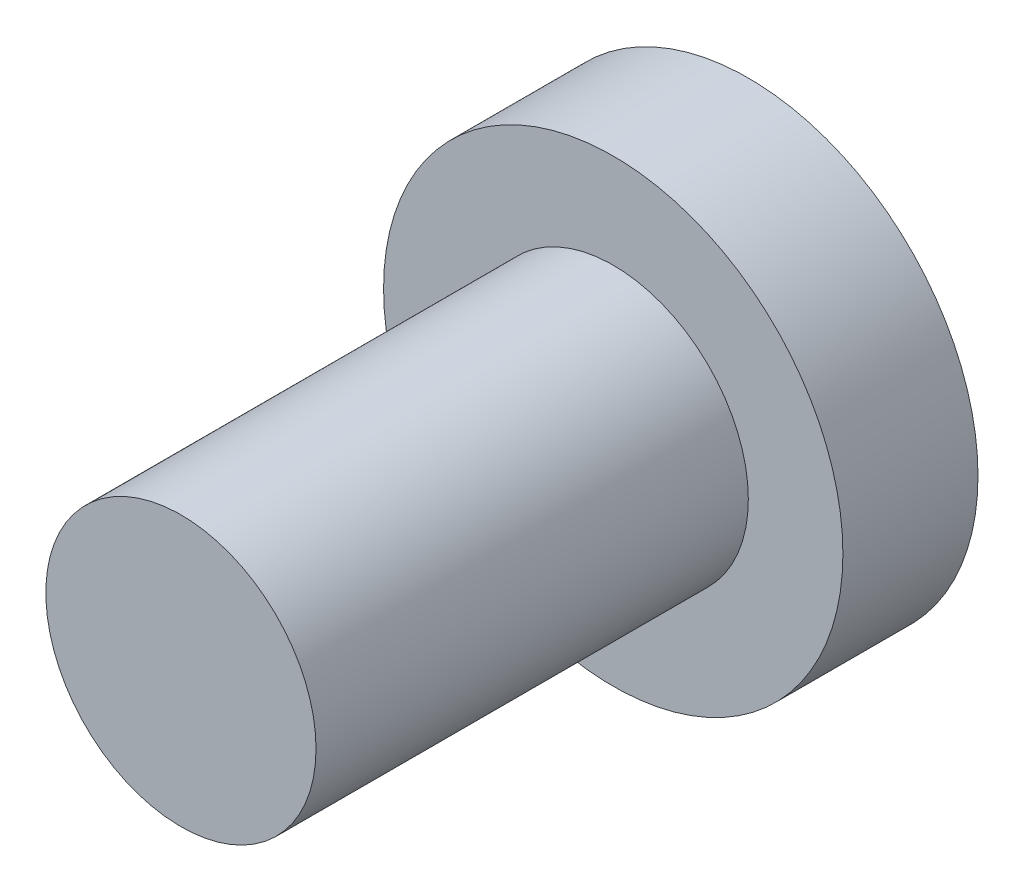
from build123d import *

# Parameters (mm, degrees)
SKETCH1_R           = 4.25
BOSS_EXTRUDE3_DEPTH = 2.5
SKETCH1_3_R         = 2.5
BOSS_EXTRUDE4_DEPTH = 8


with BuildPart() as part:
    # Sketch1 → Boss-Extrude3 (new body)
    with BuildSketch(Plane.XY):
        Circle(SKETCH1_R)
    extrude(amount=-BOSS_EXTRUDE3_DEPTH)

    # Sketch1<3> → Boss-Extrude4 (add)
    with BuildSketch(Plane.XY):
        Circle(SKETCH1_3_R)
    extrude(amount=BOSS_EXTRUDE4_DEPTH)


solid = part.part
